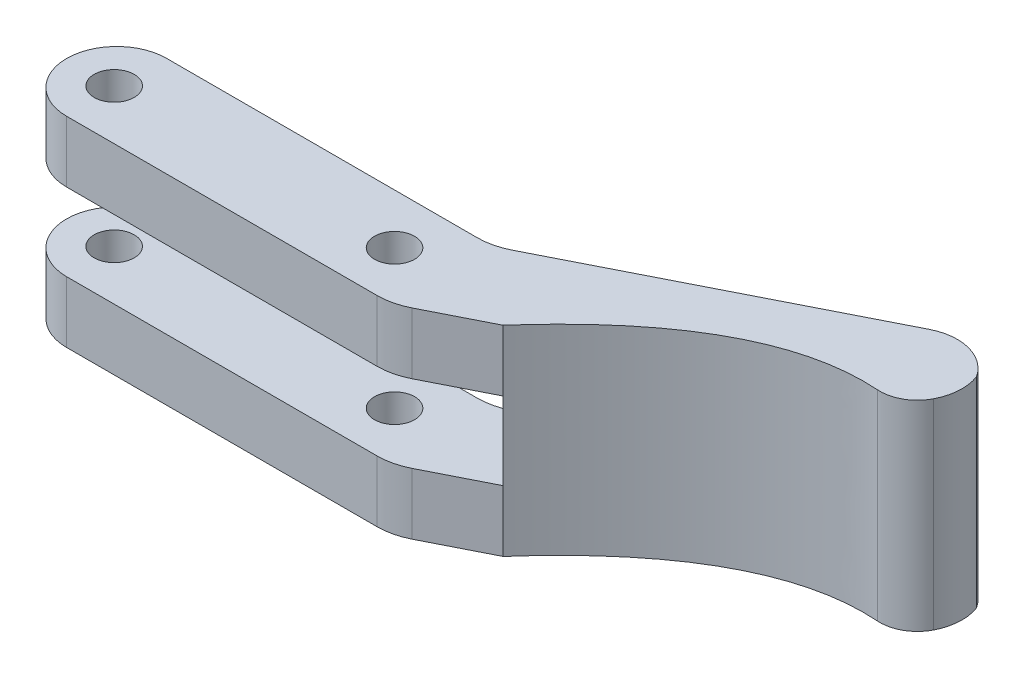
from build123d import *
from build123d.topology import SkipClean

# Parameters (mm, degrees)
SKETCH_1_W               = 30
SKETCH_1_H               = 8
SKETCH_1_R               = 1.6
EXTRUDE_1_DEPTH          = 5
EXTRUDE_2_DEPTH          = 5
EXTRUDE_START            = 11
SKETCH_3_R               = 1.6
EXTRUDE_3_DEPTH          = 11
CUT_EXTRUDE_1_DEPTH      = 0.1
CUT_EXTRUDE_1_DEPTH_BACK = 6.1
FILLET_1_R               = 4
FILLET_2_R               = 4
CUT_EXTRUDE_2_DEPTH      = 16
FILLET_3_R               = 3
FILLET_4_R               = 5


# Some blends are built 0.0001 mm under size
with BuildPart() as part:
    # 草图1 → 凸台-拉伸1 (new body)
    with BuildSketch(Plane(origin=(0, 0, 0), x_dir=(1, 0, 0), z_dir=(0, 1, 0))):
        Rectangle(SKETCH_1_W, SKETCH_1_H)
        with Locations(Location((-11.2, 0, 0), (0, 0, 270))):
            Circle(SKETCH_1_R, mode=Mode.SUBTRACT)
        with Locations(Location((11.2, 0, 0), (0, 0, 90))):
            Circle(SKETCH_1_R, mode=Mode.SUBTRACT)
    extrude(amount=EXTRUDE_1_DEPTH)

    # 草图2 → 凸台-拉伸2 (add)
    with BuildSketch(Plane(origin=(0, 5, 0), x_dir=(1, 0, 0), z_dir=(0, 1, 0))):
        Polygon((15, 4), (41.779934935, 17.521652446), (44.998681359, 11.146853201), (15, -4), align=None)
    extrude(amount=-EXTRUDE_2_DEPTH)

    # 草图3 → 凸台-拉伸3 (add)
    with SkipClean():  # the faces are left unmerged after this step: merging them gives an invalid solid
        with BuildSketch(Plane.XZ.offset(EXTRUDE_START)):
            Polygon((-15, -4), (15, -4), (41.779934935, -17.521652446), (44.998681359, -11.146853201), (15, 4), (-15, 4), align=None)
            with Locations(Location((-11.2, 0, 0), (0, 0, 270))):
                Circle(SKETCH_3_R, mode=Mode.SUBTRACT)
            with Locations(Location((11.2, 0, 0), (0, 0, 270))):
                Circle(SKETCH_3_R, mode=Mode.SUBTRACT)
        extrude(amount=-EXTRUDE_3_DEPTH)

    # 草图4 → 切除-拉伸1 (cut, two sides: drawn at the far end of the back side and taken through both)
    with BuildSketch(Plane(origin=(0, 0, 0), x_dir=(1, 0, 0), z_dir=(0, 1, 0)).offset(-CUT_EXTRUDE_1_DEPTH_BACK)):
        Polygon((17.677993493, 5.352165245), (20.899244527, -1.027594436), (19.919281017, -1.51616991), (15, -4), (-15, -4), (-15, 4), (15, 4), align=None)
    extrude(amount=CUT_EXTRUDE_1_DEPTH + CUT_EXTRUDE_1_DEPTH_BACK, mode=Mode.SUBTRACT)

    # 圆角1
    fillet_1_edges = [part.edges().sort_by_distance(p)[0] for p in [
        (-15, -8.55, -4),
        (-15, 2.55, -4),
        (-15, -8.55, 4),
        (-15, 2.55, 4),
    ]]
    fillet(fillet_1_edges, radius=FILLET_1_R - 0.0001)  # a hair under: the kernel refuses the full size

    # 圆角2
    # the kernel refuses this fillet: 4 mm, written as the material it takes off along each edge
    with BuildSketch(Plane(origin=(41.779934935, 15, -17.521652446), x_dir=(-0.8926644978329522, 0, 0.45072174820907335), z_dir=(0, -1, 0)), Plane(origin=(44.998681359, -21, -11.146853201), x_dir=(-0.8926644978329524, 0, 0.450721748209073), z_dir=(0, 1, 0))) as fillet_2_piece_1:
        with BuildLine():
            CenterArc((FILLET_2_R, -FILLET_2_R), FILLET_2_R, 90, 90)
            Line((0, -FILLET_2_R), (0, 0))
            Line((0, 0), (FILLET_2_R, 0))
        make_face()
    extrude(amount=36, mode=Mode.SUBTRACT)

    # 草图5 → 切除-拉伸2 (cut)
    with BuildSketch(Plane(origin=(0, 5, 0), x_dir=(1, 0, 0), z_dir=(0, 1, 0))):
        with BuildLine():
            Line((20.896739918, -1.022634001), (41.428023368, 9.343966208))
            add(Edge.make_bspline(
                [(20.896739918, -1.022634001), (25.980191779, 4.72849772), (33.095529518, 10.551057562), (41.428023368, 9.343966208)],
                knots=[0, 0, 0, 0, 1, 1, 1, 1], degree=3))
        make_face()
    extrude(amount=-CUT_EXTRUDE_2_DEPTH, mode=Mode.SUBTRACT)

    # 圆角3
    fillet_3_edges = [part.edges().sort_by_distance(p)[0] for p in [
        (41.428023368, -3, -9.343966208),
    ]]
    fillet(fillet_3_edges, radius=FILLET_3_R)

    # 圆角4
    fillet_4_edges = [part.edges().sort_by_distance(p)[0] for p in [
        (15, -8.55, 4),
        (15, -8.55, -4),
        (15, 2.55, 4),
        (15, 2.55, -4),
    ]]
    fillet(fillet_4_edges, radius=FILLET_4_R)


solid = part.part
